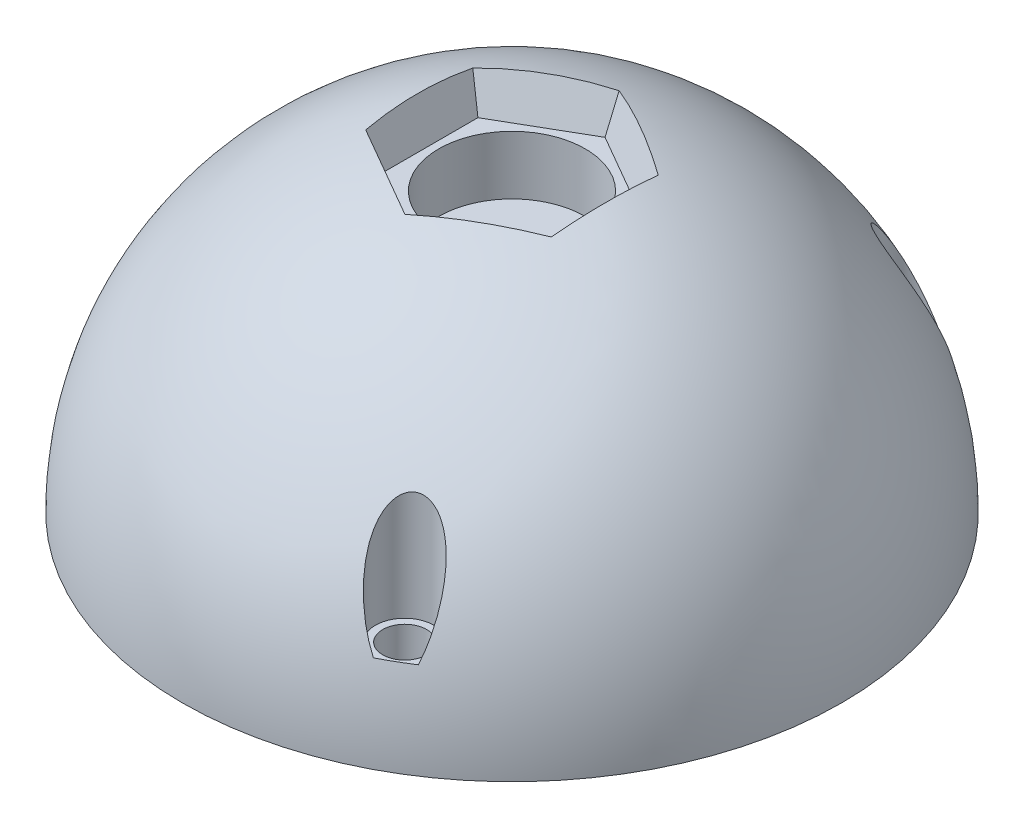
from build123d import *

# Parameters (mm, degrees)
CUT_EXTRUDE_2_DEPTH      = 10
CUT_EXTRUDE_2_DEPTH_BACK = 5
SKETCH_5_R               = 17.5
SKETCH_7_R               = 1.5
CUT_EXTRUDE_3_DEPTH      = 5
SKETCH_8_R               = 2
CUT_EXTRUDE_6_DEPTH      = 9
EXTRUDE_START            = 5
SKETCH_9_R               = 1.5
EXTRUDE_1_DEPTH          = 5
SKETCH_11_R              = 1.5
CUT_EXTRUDE_7_DEPTH      = 5
SKETCH_19_R              = 16
EXTRUDE_3_DEPTH          = 2
PATTERN_CIRCULAR_1_COUNT = 3
EXTRUDE_2_REACH          = 36.373
EXTRUDE_2_DRAFT          = 20
CUT_EXTRUDE_9_DEPTH      = 10
CUT_EXTRUDE_9_DRAFT      = 20
SKETCH_16_R              = 5
CUT_EXTRUDE_10_DEPTH     = 4
SKETCH_17_R              = 0.5
CUT_EXTRUDE_11_DEPTH     = 2
CUT_EXTRUDE_START        = -2
SKETCH_18_R              = 5
CUT_EXTRUDE_12_DEPTH     = 2


with BuildPart() as part:
    # 草图1 → 旋转2 (revolve)
    with BuildSketch(Plane.XY):
        with BuildLine():
            Line((0, 0), (-22.5, 0))
            ThreePointArc((-22.5, 0), (-15.909902577, 15.909902577), (0, 22.5))
            ThreePointArc((0, 22.5), (15.909902577, 15.909902577), (22.5, 0))
            Line((22.5, 0), (0, 0))
        make_face()
    revolve(axis=Axis((0, 0, 0), (-1, 0, 0)))

    # 草图5 → 切除-拉伸2 (cut, two sides: drawn at the far end of the back side and taken through both)
    with BuildSketch(Plane(origin=(0, 0, 0), x_dir=(1, 0, 0), z_dir=(0, 1, 0)).offset(-CUT_EXTRUDE_2_DEPTH_BACK)):
        Circle(SKETCH_5_R)
    extrude(amount=CUT_EXTRUDE_2_DEPTH + CUT_EXTRUDE_2_DEPTH_BACK, mode=Mode.SUBTRACT)

    # 草图7 → 切除-拉伸3 (cut, symmetric)
    with BuildSketch(Plane(origin=(0, 0, 0), x_dir=(1, 0, 0), z_dir=(0, 1, 0))):
        with Locations((-20, 0)):
            Circle(SKETCH_7_R)
    cut_extrude_3 = extrude(amount=CUT_EXTRUDE_3_DEPTH, both=True, mode=Mode.SUBTRACT)

    # 草图8 → 切除-拉伸6 (cut)
    with BuildSketch(Plane(origin=(0, 15, 0), x_dir=(-1, 0, 0), z_dir=(0, -1, 0))):
        with Locations((20, 0)):
            Circle(SKETCH_8_R)
    cut_extrude_6 = extrude(amount=CUT_EXTRUDE_6_DEPTH, mode=Mode.SUBTRACT)

    # 草图9 → 凸台-拉伸1 (add)
    with BuildSketch(Plane(origin=(0, -5, 0), x_dir=(1, 0, 0), z_dir=(0, 1, 0)).offset(EXTRUDE_START)):
        with Locations((-20, 0)):
            Circle(SKETCH_9_R)
    extrude_1 = extrude(amount=-EXTRUDE_1_DEPTH)

    # 草图10 → 切除-旋转1 (revolve, cut)
    with BuildSketch(Plane.XY):
        with BuildLine():
            Line((-16, 12.816005618), (-16, 5.984955635))
            Line((-16, 5.984955635), (0, 5.984955635))
            Line((0, 5.984955635), (0, 20.5))
            ThreePointArc((0, 20.5), (-8.874736189, 18.479422545), (-16, 12.816005618))
        make_face()
        with BuildLine():
            Line((0, -5.984955635), (0, -20.5))
            ThreePointArc((0, -20.5), (-8.874736189, -18.479422545), (-16, -12.816005618))
            Line((-16, -12.816005618), (-16, -5.984955635))
            Line((-16, -5.984955635), (0, -5.984955635))
        make_face()
    revolve(axis=Axis((0, 20.5, 0), (0, -1, 0)), mode=Mode.SUBTRACT)

    # 草图11 → 切除-拉伸7 (cut)
    with BuildSketch(Plane(origin=(0, 6, 0), x_dir=(1, 0, 0), z_dir=(0, 1, 0))):
        with Locations((-20, 0)):
            Circle(SKETCH_11_R)
    cut_extrude_7 = extrude(amount=-CUT_EXTRUDE_7_DEPTH, mode=Mode.SUBTRACT)

    # 草图19 → 凸台-拉伸3 (add)
    with BuildSketch(Plane.XZ.offset(-10)):
        Circle(SKETCH_19_R)
    extrude(amount=-EXTRUDE_3_DEPTH)

    # 阵列(圆周)1: 切除-拉伸3, 切除-拉伸6, 凸台-拉伸1, 切除-拉伸7 ×3 about axis
    pattern_circular_1_axis = Axis((0, -5, 0), (0, 1, 0))
    add([cut_extrude_3.rotate(pattern_circular_1_axis, i * 360 / PATTERN_CIRCULAR_1_COUNT) for i in range(1, PATTERN_CIRCULAR_1_COUNT)], mode=Mode.SUBTRACT)
    add([cut_extrude_6.rotate(pattern_circular_1_axis, i * 360 / PATTERN_CIRCULAR_1_COUNT) for i in range(1, PATTERN_CIRCULAR_1_COUNT)], mode=Mode.SUBTRACT)
    add([extrude_1.rotate(pattern_circular_1_axis, i * 360 / PATTERN_CIRCULAR_1_COUNT) for i in range(1, PATTERN_CIRCULAR_1_COUNT)])
    add([cut_extrude_7.rotate(pattern_circular_1_axis, i * 360 / PATTERN_CIRCULAR_1_COUNT) for i in range(1, PATTERN_CIRCULAR_1_COUNT)], mode=Mode.SUBTRACT)

    # Split Bodies 2
    split(bisect_by=Plane.ZX, keep=Keep.TOP)




with BuildPart() as extrude_2_long_prism_1:
    # 草图14 → 凸台-拉伸2 (the long prism of profile 1, to be tilted and cut off)
    with BuildSketch(Plane(origin=(0, 13, 0), x_dir=(-1, 0, 0), z_dir=(0, -1, 0))):
        Polygon((0, 8.660254038), (-7.5, 4.330127019), (-7.5, -4.330127019), (0, -8.660254038), (7.5, -4.330127019), (7.5, 4.330127019), align=None)
    extrude(amount=-EXTRUDE_2_REACH)
    extrude_2_tool1_sides = [extrude_2_long_prism_1.faces().sort_by_distance(p)[0] for p in [
        (3.75, 31.1865, -6.495190528),
        (7.5, 31.1865, 0),
        (3.75, 31.1865, 6.495190528),
        (-3.75, 31.1865, 6.495190528),
        (-7.5, 31.1865, 0),
        (-3.75, 31.1865, -6.495190528),
    ]]
    draft(extrude_2_tool1_sides, Plane(origin=(0, 13, 0), x_dir=(-1, 0, 0), z_dir=(0, -1, 0)), EXTRUDE_2_DRAFT)  # the draft: side faces tilted about the start plane


with BuildPart() as part_1:
    add(part.part)
    extrude_2_tool1 = extrude_2_long_prism_1.part - part.part
    add(extrude_2_tool1.solids().sort_by_distance((0, 13, 0))[0])


with BuildPart() as cut_extrude_9_tool:
    # 草图15 → 切除-拉伸9 (with draft: the straight prism first)
    with BuildSketch(Plane(origin=(0, 19, 0), x_dir=(-1, 0, 0), z_dir=(0, -1, 0))):
        Polygon((0, 6.350852961), (-5.5, 3.175426481), (-5.5, -3.175426481), (0, -6.350852961), (5.5, -3.175426481), (5.5, 3.175426481), align=None)
    extrude(amount=-CUT_EXTRUDE_9_DEPTH)
    # 切除-拉伸9: the draft: its side faces are tilted about the plane it starts from
    cut_extrude_9_sides = [cut_extrude_9_tool.faces().sort_by_distance(p)[0] for p in [
        (2.75, 24, -4.763139721),
        (5.5, 24, 0),
        (2.75, 24, 4.763139721),
        (-2.75, 24, 4.763139721),
        (-5.5, 24, 0),
        (-2.75, 24, -4.763139721),
    ]]
    draft(cut_extrude_9_sides, Plane(origin=(0, 19, 0), x_dir=(-1, 0, 0), z_dir=(0, -1, 0)), CUT_EXTRUDE_9_DRAFT)


with BuildPart() as part_2:
    add(part_1.part)

    # 切除-拉伸9: cut by cut_extrude_9_tool
    add(cut_extrude_9_tool.part, mode=Mode.SUBTRACT)

    # 草图16 → 切除-拉伸10 (cut)
    with BuildSketch(Plane(origin=(0, 19, 0), x_dir=(1, 0, 0), z_dir=(0, 1, 0))):
        Circle(SKETCH_16_R)
    extrude(amount=-CUT_EXTRUDE_10_DEPTH, mode=Mode.SUBTRACT)

    # 草图17 → 切除-拉伸11 (cut)
    with BuildSketch(Plane(origin=(0, 15, 0), x_dir=(1, 0, 0), z_dir=(0, 1, 0))):
        Circle(SKETCH_17_R)
        with Locations((4.5, 0)):
            Circle(SKETCH_17_R)
    extrude(amount=-CUT_EXTRUDE_11_DEPTH, mode=Mode.SUBTRACT)

    # 草图18 → 切除-拉伸12 (cut)
    with BuildSketch(Plane.XZ.offset(-10).offset(CUT_EXTRUDE_START)):
        Circle(SKETCH_18_R)
    extrude(amount=CUT_EXTRUDE_12_DEPTH, mode=Mode.SUBTRACT)


solid = part_2.part
